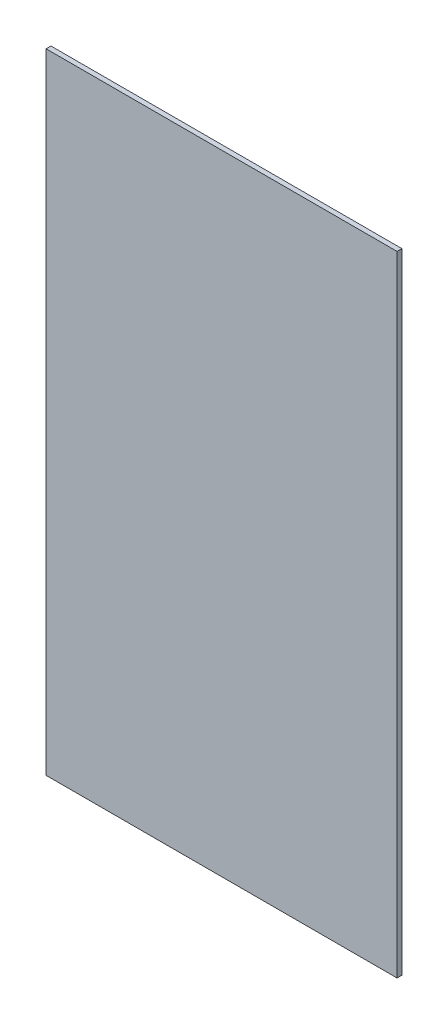
from build123d import *

# Parameters (mm, degrees)
SKETCH1_W           = 9.2075
SKETCH1_H           = 16.51
BOSS_EXTRUDE1_DEPTH = 0.127
WRAP1_START         = -0.0254
WRAP1_DEPTH         = 0.0254


# Read off the part's stored shape, not the designer's step: Wrap1
with BuildPart() as part:
    # Sketch1 → Boss-Extrude1 (new body)
    with BuildSketch(Plane.XY):
        with Locations((-14.669644351, 41.878696913)):
            Rectangle(SKETCH1_W, SKETCH1_H)
    extrude(amount=BOSS_EXTRUDE1_DEPTH)

    # Wrap1 outline → Wrap1 (cut)
    # profile 1 of 3: a face of its own
    with BuildSketch(Plane(origin=(0, 0, 0), x_dir=(-1, 0, 0), z_dir=(0, 0, -1)).offset(WRAP1_START)):
        with BuildLine():
            add(Edge.make_bspline(
                [(14.350976451, 48.39743067), (14.311790002, 48.393955574), (14.234867074, 48.387133967), (14.122442642, 48.3663891), (14.015405806, 48.338142584), (13.91381746, 48.301073106), (13.818086837, 48.254780632), (13.728663593, 48.198820695), (13.643585126, 48.135971899), (13.56582066, 48.063949566), (13.494502988, 47.985836368), (13.432501451, 47.901475843), (13.379551794, 47.811956087), (13.334740979, 47.717926691), (13.301096997, 47.618163354), (13.274473423, 47.514268252), (13.259213131, 47.404881933), (13.255487974, 47.330298129), (13.253594351, 47.292384649)],
                knots=[0, 0, 0, 0, 0.068381408, 0.134232578, 0.198524033, 0.26069346, 0.321999122, 0.383070506, 0.443897283, 0.505668836, 0.567079631, 0.627587416, 0.687368247, 0.747728967, 0.808350363, 0.870165993, 0.934000967, 1, 1, 1, 1], degree=3))
            add(Edge.make_bspline(
                [(13.253594351, 47.292384649), (13.255648309, 47.247333618), (13.259742224, 47.157538678), (13.284136323, 47.024976296), (13.324501596, 46.896576417), (13.378460513, 46.773261879), (13.446517003, 46.658229932), (13.526559826, 46.554136823), (13.617060405, 46.460791813), (13.686922099, 46.410494139), (13.721916171, 46.385299783)],
                knots=[0, 0, 0, 0, 0.127450784, 0.254032707, 0.379917634, 0.50743089, 0.633940888, 0.75692129, 0.878240662, 1, 1, 1, 1], degree=3))
            add(Edge.make_bspline(
                [(13.721916171, 46.385299783), (13.753499612, 46.365119931), (13.819606799, 46.322881555), (13.933005382, 46.27245244), (14.062786601, 46.231537183), (14.155562509, 46.211197272), (14.204093666, 46.200557448)],
                knots=[0, 0, 0, 0, 0.21602717, 0.452165684, 0.713427398, 1, 1, 1, 1], degree=3))
            Line((14.204093666, 46.200557448), (14.891000488, 46.054210487))
            add(Edge.make_bspline(
                [(14.891000488, 46.054210487), (14.915779367, 46.048959259), (14.962330101, 46.039094062), (15.027409682, 46.022840826), (15.083046712, 46.004694981), (15.116196958, 45.990183962), (15.131500189, 45.983485204)],
                knots=[0, 0, 0, 0, 0.302410693, 0.568122561, 0.800631344, 1, 1, 1, 1], degree=3))
            add(Edge.make_bspline(
                [(15.131500189, 45.983485204), (15.158087734, 45.968127069), (15.211053131, 45.937531927), (15.283215977, 45.879869264), (15.344829355, 45.810145604), (15.399763291, 45.733353571), (15.442378716, 45.648237576), (15.475503146, 45.559272862), (15.495264314, 45.465820754), (15.498451265, 45.402252188), (15.500061148, 45.37014065)],
                knots=[0, 0, 0, 0, 0.122570211, 0.244173725, 0.366965939, 0.493233173, 0.620312654, 0.746003377, 0.871694101, 1, 1, 1, 1], degree=3))
            add(Edge.make_bspline(
                [(15.500061148, 45.37014065), (15.49801611, 45.331159067), (15.493986764, 45.254353513), (15.464820754, 45.14360546), (15.421357839, 45.039053533), (15.360357021, 44.944090788), (15.287305091, 44.860001921), (15.202598514, 44.791406336), (15.10845513, 44.738070239), (15.039633987, 44.71735505), (15.004951689, 44.706915667)],
                knots=[0, 0, 0, 0, 0.131369252, 0.258837307, 0.384038153, 0.511975067, 0.637824793, 0.758188705, 0.87813961, 1, 1, 1, 1], degree=3))
            add(Edge.make_bspline(
                [(15.004951689, 44.706915667), (14.986198983, 44.703620661), (14.942721927, 44.695981384), (14.873530766, 44.68943766), (14.803401613, 44.682260536), (14.758027201, 44.681421908), (14.737999015, 44.68105174)],
                knots=[0, 0, 0, 0, 0.212681927, 0.493090641, 0.776251099, 1, 1, 1, 1], degree=3))
            Line((14.737999015, 44.68105174), (14.357329675, 44.681479317))
            add(Edge.make_bspline(
                [(14.357329675, 44.681479317), (14.330563298, 44.681274773), (14.280642832, 44.680893288), (14.21038212, 44.685801852), (14.149630282, 44.69308615), (14.112885437, 44.702564887), (14.0960194, 44.706915667)],
                knots=[0, 0, 0, 0, 0.304689746, 0.568259739, 0.801829413, 1, 1, 1, 1], degree=3))
            add(Edge.make_bspline(
                [(14.0960194, 44.706915667), (14.066335583, 44.717979136), (14.007205332, 44.7400176), (13.925725704, 44.790263298), (13.852611572, 44.853904703), (13.78756604, 44.928123827), (13.733349236, 45.010325972), (13.69297468, 45.097699306), (13.668229884, 45.188723767), (13.663378869, 45.250532455), (13.6609512, 45.28146433)],
                knots=[0, 0, 0, 0, 0.123947688, 0.246904155, 0.372712489, 0.502717764, 0.63260533, 0.75736718, 0.878575519, 1, 1, 1, 1], degree=3))
            add(Edge.make_bspline(
                [(13.6609512, 45.28146433), (13.661178871, 45.287937104), (13.66185383, 45.307126417), (13.664644274, 45.326136614), (13.66649347, 45.338734453)],
                knots=[0, 0, 0, 0, 0.337311452, 1, 1, 1, 1], degree=3))
            Line((13.66649347, 45.338734453), (13.667340506, 45.390191689))
            add(Edge.make_bspline(
                [(13.667340506, 45.390191689), (13.665675909, 45.408810878), (13.662454635, 45.444842126), (13.650082848, 45.496712093), (13.627275037, 45.542714002), (13.596826947, 45.58261148), (13.559725052, 45.614708326), (13.517982944, 45.640124599), (13.470370492, 45.654819517), (13.436890869, 45.657152229), (13.419862452, 45.658338694)],
                knots=[0, 0, 0, 0, 0.138165926, 0.267374202, 0.39159216, 0.514993781, 0.635999027, 0.75235309, 0.874041745, 1, 1, 1, 1], degree=3))
            add(Edge.make_bspline(
                [(13.419862452, 45.658338694), (13.399371505, 45.656802431), (13.359287809, 45.653797247), (13.303085842, 45.63368823), (13.253013713, 45.602361234), (13.21154406, 45.558115071), (13.178496527, 45.503772776), (13.153312761, 45.441488483), (13.138539014, 45.370501539), (13.136455736, 45.320639765), (13.135359256, 45.294396293)],
                knots=[0, 0, 0, 0, 0.118909284, 0.232606296, 0.342759225, 0.459139682, 0.581234599, 0.71043286, 0.847593726, 1, 1, 1, 1], degree=3))
            add(Edge.make_bspline(
                [(13.135359256, 45.294396293), (13.138266538, 45.238447871), (13.144031768, 45.127500432), (13.182712674, 44.965975293), (13.241120079, 44.811138004), (13.322346718, 44.666593779), (13.421475442, 44.533826944), (13.539285066, 44.419868909), (13.671223799, 44.322122829), (13.769971326, 44.275211601), (13.819829608, 44.25152581)],
                knots=[0, 0, 0, 0, 0.127253304, 0.25234721, 0.376095662, 0.502811598, 0.628369682, 0.751742678, 0.874653227, 1, 1, 1, 1], degree=3))
            add(Edge.make_bspline(
                [(13.819829608, 44.25152581), (13.859380985, 44.239484459), (13.941934749, 44.214351102), (14.072698138, 44.18865863), (14.210421547, 44.171578085), (14.304111335, 44.169453983), (14.350963822, 44.168391759)],
                knots=[0, 0, 0, 0, 0.229678945, 0.479398274, 0.73965694, 1, 1, 1, 1], degree=3))
            Line((14.350963822, 44.168391759), (14.766301216, 44.168391759))
            add(Edge.make_bspline(
                [(14.766301216, 44.168391759), (14.811731377, 44.170463898), (14.900942153, 44.174532935), (15.03106654, 44.192395531), (15.155263783, 44.218739837), (15.272122113, 44.256558688), (15.382254999, 44.304397489), (15.486174349, 44.360289731), (15.582842952, 44.427552109), (15.672194356, 44.504064011), (15.753084898, 44.588449708), (15.824216232, 44.679929285), (15.884522021, 44.77804288), (15.933273757, 44.8830547), (15.972646442, 44.994015319), (16.000785146, 45.111680466), (16.019982329, 45.235904364), (16.023125288, 45.321110958), (16.02472938, 45.36459838)],
                knots=[0, 0, 0, 0, 0.070173963, 0.137799946, 0.202502971, 0.265936494, 0.327038802, 0.38765852, 0.447782381, 0.508463564, 0.568976969, 0.627924422, 0.687026896, 0.746352577, 0.806335358, 0.868473449, 0.932871971, 1, 1, 1, 1], degree=3))
            add(Edge.make_bspline(
                [(16.02472938, 45.36459838), (16.023480215, 45.402201794), (16.021014588, 45.476424143), (16.007024829, 45.585533174), (15.984378695, 45.690336425), (15.955856912, 45.791378742), (15.915593827, 45.887047671), (15.870314267, 45.980004279), (15.814142819, 46.067454471), (15.751588702, 46.150934898), (15.681251545, 46.228046897), (15.605583742, 46.299863238), (15.522615847, 46.363650763), (15.434076557, 46.421064014), (15.339216893, 46.470806617), (15.239120482, 46.51468416), (15.132653093, 46.5505905), (15.058974535, 46.569007735), (15.021578499, 46.578355523)],
                knots=[0, 0, 0, 0, 0.065994807, 0.130261836, 0.192676212, 0.254053028, 0.314151421, 0.374557459, 0.435264777, 0.49620965, 0.557412624, 0.618187223, 0.679031429, 0.740775738, 0.803131625, 0.866768749, 0.932377605, 1, 1, 1, 1], degree=3))
            Line((15.021578499, 46.578355523), (14.331828377, 46.720199389))
            add(Edge.make_bspline(
                [(14.331828377, 46.720199389), (14.308941618, 46.724881987), (14.265932347, 46.733681621), (14.205569214, 46.747148173), (14.153803568, 46.761809951), (14.122454087, 46.772813583), (14.108027651, 46.777877245)],
                knots=[0, 0, 0, 0, 0.302918848, 0.569251348, 0.801777649, 1, 1, 1, 1], degree=3))
            add(Edge.make_bspline(
                [(14.108027651, 46.777877245), (14.084239707, 46.789835799), (14.036815829, 46.813676487), (13.972734114, 46.861245115), (13.916482007, 46.918902998), (13.86800976, 46.984648387), (13.828997867, 47.057780204), (13.801626654, 47.136063346), (13.782956041, 47.218552728), (13.78046197, 47.275344733), (13.779186295, 47.304392901)],
                knots=[0, 0, 0, 0, 0.121611957, 0.24244678, 0.36294466, 0.488851438, 0.614852694, 0.74046772, 0.867253549, 1, 1, 1, 1], degree=3))
            add(Edge.make_bspline(
                [(13.779186295, 47.304392901), (13.781538005, 47.344989462), (13.786088469, 47.423542154), (13.820053281, 47.534750946), (13.871660496, 47.635265568), (13.946283164, 47.719900991), (14.03513918, 47.791329499), (14.140224075, 47.843116821), (14.258043786, 47.878182059), (14.341780405, 47.885376793), (14.385141154, 47.889102392)],
                knots=[0, 0, 0, 0, 0.129699422, 0.250963102, 0.369076011, 0.488549425, 0.609183097, 0.731673303, 0.86105426, 1, 1, 1, 1], degree=3))
            Line((14.385141154, 47.889102392), (14.704981735, 47.89571541))
            Line((14.704981735, 47.89571541), (14.736905715, 47.89571541))
            add(Edge.make_bspline(
                [(14.736905715, 47.89571541), (14.778994364, 47.894309327), (14.859981812, 47.891603726), (14.9748024, 47.864923789), (15.077525028, 47.823585849), (15.167559577, 47.764352496), (15.242894795, 47.686632873), (15.306677678, 47.593937696), (15.355926754, 47.483916924), (15.376578725, 47.4036161), (15.387368323, 47.361663025)],
                knots=[0, 0, 0, 0, 0.136643935, 0.262931786, 0.380987403, 0.495106145, 0.610495653, 0.730734126, 0.859322349, 1, 1, 1, 1], degree=3))
            add(Edge.make_bspline(
                [(15.387368323, 47.361663025), (15.393113069, 47.343653528), (15.404051064, 47.309363449), (15.426043865, 47.262840466), (15.452442765, 47.223798046), (15.482595928, 47.192238621), (15.517240693, 47.168295854), (15.555583184, 47.151118093), (15.598565397, 47.143059441), (15.628126382, 47.143461538), (15.643236458, 47.143667069)],
                knots=[0, 0, 0, 0, 0.154020825, 0.293255627, 0.417897251, 0.536846803, 0.646878629, 0.759290409, 0.876961469, 1, 1, 1, 1], degree=3))
            add(Edge.make_bspline(
                [(15.643236458, 47.143667069), (15.661819798, 47.144781023), (15.697760289, 47.14693543), (15.748727004, 47.162181406), (15.794126128, 47.186592232), (15.83292305, 47.220176011), (15.86496971, 47.261041448), (15.886913714, 47.309266903), (15.901196515, 47.362714381), (15.903469812, 47.4003633), (15.904646862, 47.419856861)],
                knots=[0, 0, 0, 0, 0.130879693, 0.253123515, 0.371609903, 0.49167618, 0.612368621, 0.734708751, 0.862639586, 1, 1, 1, 1], degree=3))
            add(Edge.make_bspline(
                [(15.904646862, 47.419856861), (15.902380443, 47.453600645), (15.897524746, 47.525895121), (15.86552316, 47.635983762), (15.820869949, 47.751380949), (15.779055844, 47.825512847), (15.757776706, 47.863238465)],
                knots=[0, 0, 0, 0, 0.214498866, 0.459553764, 0.724967674, 1, 1, 1, 1], degree=3))
            add(Edge.make_bspline(
                [(15.757776706, 47.863238465), (15.730556342, 47.905918066), (15.677026418, 47.989849191), (15.578595364, 48.100477864), (15.468573481, 48.195696373), (15.347607337, 48.274978403), (15.218334216, 48.337687827), (15.083480711, 48.383513405), (14.943263763, 48.411161025), (14.848043492, 48.414734529), (14.799887697, 48.416541759)],
                knots=[0, 0, 0, 0, 0.131002714, 0.257622025, 0.382065907, 0.507094114, 0.631271718, 0.753386832, 0.8752802, 1, 1, 1, 1], degree=3))
            Line((14.799887697, 48.416541759), (14.7624449, 48.417464569))
            Line((14.7624449, 48.417464569), (14.350976451, 48.39743067))
        make_face()
    # profile 2 of 3: a face of its own
    with BuildSketch(Plane(origin=(0, 0, 0), x_dir=(-1, 0, 0), z_dir=(0, 0, -1)).offset(WRAP1_START)):
        with BuildLine():
            Line((13.720068747, 41.369917276), (14.6263165, 41.369917276))
            add(Edge.make_bspline(
                [(14.6263165, 41.369917276), (14.669093855, 41.369872706), (14.745473106, 41.369793126), (14.851168873, 41.374356331), (14.942407472, 41.383022339), (14.999179852, 41.394668785), (15.027120769, 41.400400664)],
                knots=[0, 0, 0, 0, 0.318510269, 0.56870221, 0.787733828, 1, 1, 1, 1], degree=3))
            add(Edge.make_bspline(
                [(15.027120769, 41.400400664), (15.061145897, 41.409751144), (15.128438456, 41.428243883), (15.225830588, 41.464526366), (15.318360309, 41.507810721), (15.405634883, 41.558730572), (15.487046617, 41.617499137), (15.564245993, 41.68233737), (15.636449699, 41.754484659), (15.702661857, 41.833798059), (15.762157439, 41.918393517), (15.815526425, 42.006706862), (15.860779079, 42.099064925), (15.897906285, 42.195495904), (15.926408357, 42.29576513), (15.947520132, 42.399516864), (15.961991862, 42.506923963), (15.964394422, 42.579933812), (15.965611833, 42.616928941)],
                knots=[0, 0, 0, 0, 0.063811826, 0.126202648, 0.187749821, 0.248413496, 0.308697506, 0.369176777, 0.43062052, 0.493095825, 0.555841206, 0.617551999, 0.679581233, 0.74164797, 0.804234915, 0.867922634, 0.933074519, 1, 1, 1, 1], degree=3))
            add(Edge.make_bspline(
                [(15.965611833, 42.616928941), (15.964986055, 42.649917623), (15.963754242, 42.714854236), (15.951452465, 42.810655723), (15.93601886, 42.903922492), (15.910790349, 42.993926853), (15.882326456, 43.081929408), (15.844369901, 43.165917579), (15.802293633, 43.248025867), (15.752089358, 43.32600106), (15.69739908, 43.400269448), (15.637522962, 43.469477381), (15.57296852, 43.533484115), (15.502601338, 43.591168281), (15.428370169, 43.644728004), (15.348409416, 43.691235355), (15.26476229, 43.734586593), (15.205638203, 43.757332805), (15.175838349, 43.768797402)],
                knots=[0, 0, 0, 0, 0.066387297, 0.130680161, 0.194287761, 0.256551602, 0.318704213, 0.380335098, 0.441900456, 0.504336927, 0.566834936, 0.627494502, 0.688435421, 0.749640699, 0.810543758, 0.872535352, 0.935754986, 1, 1, 1, 1], degree=3))
            add(Edge.make_bspline(
                [(15.175838349, 43.768797402), (15.136954209, 43.78157255), (15.060128139, 43.806813289), (14.938199666, 43.831782435), (14.804112973, 43.842921618), (14.709689296, 43.843972641), (14.658559811, 43.844541759)],
                knots=[0, 0, 0, 0, 0.233429035, 0.461201792, 0.70824611, 1, 1, 1, 1], degree=3))
            Line((14.658559811, 43.844541759), (13.618950283, 43.845464569))
            add(Edge.make_bspline(
                [(13.618950283, 43.845464569), (13.580884498, 43.845774096), (13.51109694, 43.846341566), (13.415132523, 43.834242668), (13.337466625, 43.810457177), (13.276156008, 43.772425466), (13.23467151, 43.71593396), (13.207139647, 43.64514184), (13.193185078, 43.557490333), (13.194022358, 43.493879596), (13.194476803, 43.45935399)],
                knots=[0, 0, 0, 0, 0.16636625, 0.305006043, 0.421258069, 0.519485231, 0.614560497, 0.722085416, 0.84915802, 1, 1, 1, 1], degree=3))
            Line((13.194476803, 43.45935399), (13.195399613, 39.890565062))
            add(Edge.make_bspline(
                [(13.195399613, 39.890565062), (13.196253854, 39.867258859), (13.197870108, 39.823162676), (13.210589641, 39.761747349), (13.231445456, 39.709400861), (13.262199366, 39.667546468), (13.299932231, 39.633987339), (13.346614239, 39.610525258), (13.401334001, 39.597872566), (13.440118375, 39.596901965), (13.460505766, 39.596391759)],
                knots=[0, 0, 0, 0, 0.15401908, 0.291409693, 0.412808564, 0.523598877, 0.631833239, 0.743851905, 0.865353208, 1, 1, 1, 1], degree=3))
            add(Edge.make_bspline(
                [(13.460505766, 39.596391759), (13.482468089, 39.59670004), (13.523231567, 39.59727223), (13.579502972, 39.611602532), (13.62654742, 39.63443748), (13.663969289, 39.669662483), (13.68950477, 39.717813307), (13.709085705, 39.776364555), (13.71795981, 39.84831528), (13.719326961, 39.899974889), (13.720068747, 39.928004251)],
                knots=[0, 0, 0, 0, 0.134157722, 0.249005317, 0.352782925, 0.451534602, 0.558003784, 0.68328573, 0.828157832, 1, 1, 1, 1], degree=3))
            Line((13.720068747, 39.928004251), (13.720068747, 41.369917276))
        make_face()
        with BuildLine():
            Line((13.720068747, 43.320795435), (14.639262896, 43.320795435))
            add(Edge.make_bspline(
                [(14.639262896, 43.320795435), (14.66942635, 43.31959787), (14.728373981, 43.317257501), (14.814165749, 43.308119165), (14.895294209, 43.293776717), (14.970965902, 43.271905033), (15.042608493, 43.246791965), (15.108834494, 43.214023664), (15.169466417, 43.175151279), (15.225610182, 43.131697047), (15.275084268, 43.082690002), (15.319525059, 43.029657199), (15.355956922, 42.971210063), (15.387276064, 42.909034463), (15.409544184, 42.841899217), (15.428021037, 42.771105503), (15.437443622, 42.69537482), (15.439761338, 42.64342728), (15.440943601, 42.616928941)],
                knots=[0, 0, 0, 0, 0.075224664, 0.147009553, 0.214898019, 0.280258111, 0.343138055, 0.403888438, 0.463926896, 0.522419978, 0.580488607, 0.637186978, 0.694458989, 0.751777259, 0.810270342, 0.870392129, 0.933887278, 1, 1, 1, 1], degree=3))
            add(Edge.make_bspline(
                [(15.440943601, 42.616928941), (15.439777799, 42.590426253), (15.437492354, 42.538470186), (15.42776336, 42.462206092), (15.409786237, 42.390352305), (15.387040472, 42.322337996), (15.357124001, 42.258873952), (15.32070423, 42.199819848), (15.27940047, 42.143471478), (15.229933879, 42.093447547), (15.176807874, 42.046855152), (15.11816231, 42.00690871), (15.054966069, 41.973890952), (14.987963498, 41.945842121), (14.916478929, 41.923790785), (14.840829152, 41.907169638), (14.760759923, 41.896770591), (14.706008837, 41.89532635), (14.677957756, 41.89458641)],
                knots=[0, 0, 0, 0, 0.067406719, 0.132144633, 0.194962536, 0.255340212, 0.314145897, 0.372789979, 0.431475807, 0.491241944, 0.551161551, 0.610845676, 0.671050713, 0.732083974, 0.795193603, 0.860884459, 0.928725772, 1, 1, 1, 1], degree=3))
            Line((14.677957756, 41.89458641), (13.720068747, 41.89458641))
            Line((13.720068747, 41.89458641), (13.720068747, 43.320795435))
        make_face(mode=Mode.SUBTRACT)
    # profile 3 of 3: a face of its own
    with BuildSketch(Plane(origin=(0, 0, 0), x_dir=(-1, 0, 0), z_dir=(0, 0, -1)).offset(WRAP1_START)):
        with BuildLine():
            Line((15.530541829, 36.177465375), (13.625098739, 39.091844271))
            add(Edge.make_bspline(
                [(13.625098739, 39.091844271), (13.6138301, 39.10756503), (13.592500488, 39.137321744), (13.55966932, 39.17725479), (13.527074481, 39.209140814), (13.485525776, 39.241383174), (13.427603637, 39.269419235), (13.377726438, 39.27149105), (13.3524315, 39.272541759)],
                knots=[0, 0, 0, 0, 0.169217477, 0.320299826, 0.451756639, 0.567066417, 0.780440194, 1, 1, 1, 1], degree=3))
            add(Edge.make_bspline(
                [(13.3524315, 39.272541759), (13.326733484, 39.270492425), (13.275238488, 39.266385864), (13.206951254, 39.230921553), (13.148049019, 39.183648107), (13.128336402, 39.139074426), (13.118732446, 39.117358198)],
                knots=[0, 0, 0, 0, 0.25722592, 0.515442432, 0.76392431, 1, 1, 1, 1], degree=3))
            add(Edge.make_bspline(
                [(13.118732446, 39.117358198), (13.115985238, 39.108182156), (13.110296766, 39.089181896), (13.106709031, 39.054312682), (13.106875581, 39.005592052), (13.106206975, 38.967101526), (13.105800482, 38.943700403)],
                knots=[0, 0, 0, 0, 0.164010857, 0.3396071, 0.598500264, 1, 1, 1, 1], degree=3))
            Line((13.105800482, 38.943700403), (13.106723292, 35.36684343))
            add(Edge.make_bspline(
                [(13.106723292, 35.36684343), (13.106827811, 35.339526142), (13.107004332, 35.293390587), (13.109498959, 35.233381236), (13.118103036, 35.189238819), (13.127352617, 35.165007216), (13.131664409, 35.153711394)],
                knots=[0, 0, 0, 0, 0.37923184, 0.640476136, 0.832404082, 1, 1, 1, 1], degree=3))
            add(Edge.make_bspline(
                [(13.131664409, 35.153711394), (13.14486845, 35.134672974), (13.170674191, 35.097464628), (13.226124209, 35.056457936), (13.292142632, 35.030590937), (13.340170735, 35.02652468), (13.365363464, 35.024391759)],
                knots=[0, 0, 0, 0, 0.24768333, 0.484067853, 0.72937223, 1, 1, 1, 1], degree=3))
            add(Edge.make_bspline(
                [(13.365363464, 35.024391759), (13.38546827, 35.025495606), (13.423807335, 35.027600597), (13.47753071, 35.04229823), (13.523346742, 35.067247465), (13.562359852, 35.100557883), (13.591008978, 35.145320951), (13.613549168, 35.197570649), (13.626919828, 35.259639432), (13.629843106, 35.303907416), (13.631392426, 35.327369189)],
                knots=[0, 0, 0, 0, 0.132129688, 0.251966061, 0.362463643, 0.472905592, 0.58518714, 0.70851143, 0.845512762, 1, 1, 1, 1], degree=3))
            Line((13.631392426, 35.327369189), (13.631392426, 38.126818146))
            Line((13.631392426, 38.126818146), (15.530541829, 35.193138728))
            add(Edge.make_bspline(
                [(15.530541829, 35.193138728), (15.549350833, 35.166573787), (15.584442654, 35.117011769), (15.652573455, 35.062698259), (15.72539123, 35.027866885), (15.776816996, 35.025537603), (15.802114866, 35.024391759)],
                knots=[0, 0, 0, 0, 0.290623159, 0.542213511, 0.774801158, 1, 1, 1, 1], degree=3))
            add(Edge.make_bspline(
                [(15.802114866, 35.024391759), (15.821309073, 35.025151593), (15.857797652, 35.026596052), (15.909075942, 35.040949534), (15.953559839, 35.063835247), (15.989765063, 35.09762186), (16.018130125, 35.140646816), (16.03774995, 35.193068901), (16.050839718, 35.254092088), (16.053092324, 35.297734812), (16.054288154, 35.320903208)],
                knots=[0, 0, 0, 0, 0.129823068, 0.246796295, 0.357906111, 0.465732929, 0.578612523, 0.704188565, 0.842964052, 1, 1, 1, 1], degree=3))
            Line((16.054288154, 35.320903208), (16.055210963, 38.956740614))
            add(Edge.make_bspline(
                [(16.055210963, 38.956740614), (16.054696066, 38.982321552), (16.053727175, 39.030457639), (16.041655378, 39.09727906), (16.022902568, 39.15456038), (15.994246153, 39.200819441), (15.956108637, 39.235982283), (15.910035291, 39.260142735), (15.855181851, 39.273447033), (15.816351383, 39.272856567), (15.795648884, 39.272541759)],
                knots=[0, 0, 0, 0, 0.162079845, 0.3049884, 0.429154783, 0.542410064, 0.646080047, 0.75442866, 0.869073422, 1, 1, 1, 1], degree=3))
            add(Edge.make_bspline(
                [(15.795648884, 39.272541759), (15.773706832, 39.272147035), (15.732382302, 39.271403631), (15.674891645, 39.257694785), (15.626714675, 39.233547404), (15.588991922, 39.197309299), (15.560369666, 39.149682536), (15.541800981, 39.088980695), (15.531347762, 39.015195191), (15.530226331, 38.961598211), (15.529619921, 38.932615862)],
                knots=[0, 0, 0, 0, 0.130999231, 0.246717201, 0.350532776, 0.449563782, 0.555402612, 0.679484004, 0.826682279, 1, 1, 1, 1], degree=3))
            Line((15.529619921, 38.932615862), (15.530541829, 36.177465375))
        make_face()
    extrude(amount=WRAP1_DEPTH, mode=Mode.SUBTRACT)


solid = part.part
